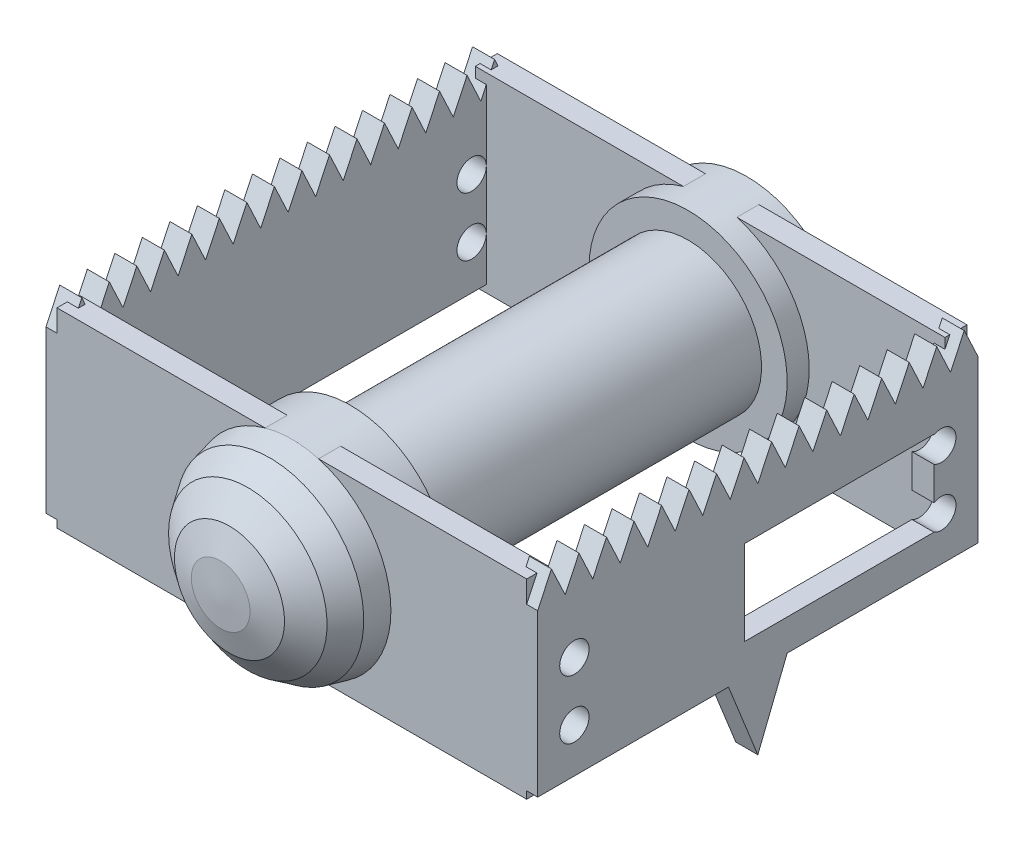
from build123d import *

# Parameters (mm, degrees)
PLACA_DELANTERA_START               = 203
PLACA_DELANTERA_DEPTH               = 3
AGUJERO_PLACA_DELANTERA_1_PROFILE_R = 2
AGUJERO_PLACA_DELANTERA_2_PROFILE_R = 2
AGUJERO_PLACA_DELANTERA_3_PROFILE_R = 2
AGUJERO_PLACA_DELANTERA_4_PROFILE_R = 2
PLACA_TRASERA_START                 = 139
PLACA_TRASERA_DEPTH                 = 3
AGUJERO_PLACA_TRASERA_1_PROFILE_R   = 2
AGUJERO_PLACA_TRASERA_2_PROFILE_R   = 2
AGUJERO_PLACA_TRASERA_3_PROFILE_R   = 2
AGUJERO_PLACA_TRASERA_4_PROFILE_R   = 2
MARCO_INTERIOR_START                = 86
SK_MARCO_INTERIOR_W                 = 64
SK_MARCO_INTERIOR_H                 = 26
SK_MARCO_INTERIOR_R                 = 11
MARCO_INTERIOR_DEPTH                = 3
MARCO_EXTERIOR_START                = 143
SK_MARCO_EXTERIOR_W                 = 64
SK_MARCO_EXTERIOR_H                 = 26
SK_MARCO_EXTERIOR_R                 = 11
MARCO_EXTERIOR_DEPTH                = 3
CROQUIS17_W                         = 25.795648089
CROQUIS17_H                         = 11.561302328
CORTAR_EXTRUIR1_DEPTH               = 10


with BuildPart() as part:
    # Sk_Eje_cuerpo → Eje_cuerpo (revolve)
    with BuildSketch(Plane(origin=(0, 0, 0), x_dir=(1, 0, 0), z_dir=(0, 1, 0))):
        Polygon((183.5, -84), (186, -84), (186, -92), (182.5, -92), (182.5, -138), (186, -138), (186, -146), (185.3, -149), (183.3, -152), (180, -154.5), (176.5, -155.7), (172.5, -156), (172.5, -147), (183.5, -147), (183.5, -138.5), (178.8, -138.5), (178.8, -91.5), (183.5, -91.5), align=None)
    revolve(axis=Axis((172.5, 0, 62.1), (0, 0, 1)))



with BuildPart() as body_2:
    # Sk_Placa_delantera → Placa_delantera (new body)
    with BuildSketch(Plane(origin=(0, 0, 0), x_dir=(0, 0, -1), z_dir=(1, 0, 0)).offset(PLACA_DELANTERA_START)):
        Polygon((-86, -12), (-112, -12), (-116, -22), (-120, -12), (-146, -12), (-146, 10), (-144.125, 14), (-142.25, 10), (-140.375, 14), (-138.5, 10), (-136.625, 14), (-134.75, 10), (-132.875, 14), (-131, 10), (-129.125, 14), (-127.25, 10), (-125.375, 14), (-123.5, 10), (-121.625, 14), (-119.75, 10), (-117.875, 14), (-116, 10), (-114.125, 14), (-112.25, 10), (-110.375, 14), (-108.5, 10), (-106.625, 14), (-104.75, 10), (-102.875, 14), (-101, 10), (-99.125, 14), (-97.25, 10), (-95.375, 14), (-93.5, 10), (-91.625, 14), (-89.75, 10), (-87.875, 14), (-86, 10), align=None)
    extrude(amount=PLACA_DELANTERA_DEPTH)

    # Agujero_Placa_delantera_1: sweep along a curve in space
    with BuildLine() as agujero_placa_delantera_1_path:
        Line((201.5, -6, 91), (207.5, -6, 91))
    # Agujero_Placa_delantera_1 profile (on start of the path) → Agujero_Placa_delantera_1 (sweep, cut)
    with BuildSketch(Plane(origin=(201.5, -6, 91), x_dir=(0, 0, 1), z_dir=(1, 0, 0))):
        Circle(AGUJERO_PLACA_DELANTERA_1_PROFILE_R)
    sweep(path=agujero_placa_delantera_1_path.line, mode=Mode.SUBTRACT)

    # Agujero_Placa_delantera_2: sweep along a curve in space
    with BuildLine() as agujero_placa_delantera_2_path:
        Line((201.5, 2, 91), (207.5, 2, 91))
    # Agujero_Placa_delantera_2 profile (on start of the path) → Agujero_Placa_delantera_2 (sweep, cut)
    with BuildSketch(Plane(origin=(201.5, 2, 91), x_dir=(0, 0, 1), z_dir=(1, 0, 0))):
        Circle(AGUJERO_PLACA_DELANTERA_2_PROFILE_R)
    sweep(path=agujero_placa_delantera_2_path.line, mode=Mode.SUBTRACT)

    # Agujero_Placa_delantera_3: sweep along a curve in space
    with BuildLine() as agujero_placa_delantera_3_path:
        Line((201.5, -6, 141), (207.5, -6, 141))
    # Agujero_Placa_delantera_3 profile (on start of the path) → Agujero_Placa_delantera_3 (sweep, cut)
    with BuildSketch(Plane(origin=(201.5, -6, 141), x_dir=(0, 0, 1), z_dir=(1, 0, 0))):
        Circle(AGUJERO_PLACA_DELANTERA_3_PROFILE_R)
    sweep(path=agujero_placa_delantera_3_path.line, mode=Mode.SUBTRACT)

    # Agujero_Placa_delantera_4: sweep along a curve in space
    with BuildLine() as agujero_placa_delantera_4_path:
        Line((201.5, 2, 141), (207.5, 2, 141))
    # Agujero_Placa_delantera_4 profile (on start of the path) → Agujero_Placa_delantera_4 (sweep, cut)
    with BuildSketch(Plane(origin=(201.5, 2, 141), x_dir=(0, 0, 1), z_dir=(1, 0, 0))):
        Circle(AGUJERO_PLACA_DELANTERA_4_PROFILE_R)
    sweep(path=agujero_placa_delantera_4_path.line, mode=Mode.SUBTRACT)


with BuildPart() as body_3:
    # Sk_Placa_trasera → Placa_trasera (new body)
    with BuildSketch(Plane(origin=(0, 0, 0), x_dir=(0, 0, -1), z_dir=(1, 0, 0)).offset(PLACA_TRASERA_START)):
        Polygon((-86, -12), (-146, -12), (-146, 10), (-144.125, 14), (-142.25, 10), (-140.375, 14), (-138.5, 10), (-136.625, 14), (-134.75, 10), (-132.875, 14), (-131, 10), (-129.125, 14), (-127.25, 10), (-125.375, 14), (-123.5, 10), (-121.625, 14), (-119.75, 10), (-117.875, 14), (-116, 10), (-114.125, 14), (-112.25, 10), (-110.375, 14), (-108.5, 10), (-106.625, 14), (-104.75, 10), (-102.875, 14), (-101, 10), (-99.125, 14), (-97.25, 10), (-95.375, 14), (-93.5, 10), (-91.625, 14), (-89.75, 10), (-87.875, 14), (-86, 10), align=None)
    extrude(amount=PLACA_TRASERA_DEPTH)

    # Agujero_Placa_trasera_1: sweep along a curve in space
    with BuildLine() as agujero_placa_trasera_1_path:
        Line((137.5, -6, 91), (143.5, -6, 91))
    # Agujero_Placa_trasera_1 profile (on start of the path) → Agujero_Placa_trasera_1 (sweep, cut)
    with BuildSketch(Plane(origin=(137.5, -6, 91), x_dir=(0, 0, 1), z_dir=(1, 0, 0))):
        Circle(AGUJERO_PLACA_TRASERA_1_PROFILE_R)
    sweep(path=agujero_placa_trasera_1_path.line, mode=Mode.SUBTRACT)

    # Agujero_Placa_trasera_2: sweep along a curve in space
    with BuildLine() as agujero_placa_trasera_2_path:
        Line((137.5, 2, 91), (143.5, 2, 91))
    # Agujero_Placa_trasera_2 profile (on start of the path) → Agujero_Placa_trasera_2 (sweep, cut)
    with BuildSketch(Plane(origin=(137.5, 2, 91), x_dir=(0, 0, 1), z_dir=(1, 0, 0))):
        Circle(AGUJERO_PLACA_TRASERA_2_PROFILE_R)
    sweep(path=agujero_placa_trasera_2_path.line, mode=Mode.SUBTRACT)

    # Agujero_Placa_trasera_3: sweep along a curve in space
    with BuildLine() as agujero_placa_trasera_3_path:
        Line((137.5, -6, 141), (143.5, -6, 141))
    # Agujero_Placa_trasera_3 profile (on start of the path) → Agujero_Placa_trasera_3 (sweep, cut)
    with BuildSketch(Plane(origin=(137.5, -6, 141), x_dir=(0, 0, 1), z_dir=(1, 0, 0))):
        Circle(AGUJERO_PLACA_TRASERA_3_PROFILE_R)
    sweep(path=agujero_placa_trasera_3_path.line, mode=Mode.SUBTRACT)

    # Agujero_Placa_trasera_4: sweep along a curve in space
    with BuildLine() as agujero_placa_trasera_4_path:
        Line((137.5, 2, 141), (143.5, 2, 141))
    # Agujero_Placa_trasera_4 profile (on start of the path) → Agujero_Placa_trasera_4 (sweep, cut)
    with BuildSketch(Plane(origin=(137.5, 2, 141), x_dir=(0, 0, 1), z_dir=(1, 0, 0))):
        Circle(AGUJERO_PLACA_TRASERA_4_PROFILE_R)
    sweep(path=agujero_placa_trasera_4_path.line, mode=Mode.SUBTRACT)


with BuildPart() as part_1:
    add(part.part)

    add(body_2.part)  # Marco_interior merges body 2

    add(body_3.part)  # Marco_interior merges body 3
    # Sk_Marco_interior → Marco_interior (add)
    with BuildSketch(Plane.XY.offset(MARCO_INTERIOR_START)):
        with Locations((172.5, 0)):
            Rectangle(SK_MARCO_INTERIOR_W, SK_MARCO_INTERIOR_H)
        with Locations((172.5, 0)):
            Circle(SK_MARCO_INTERIOR_R, mode=Mode.SUBTRACT)
    extrude(amount=MARCO_INTERIOR_DEPTH)

    # Sk_Marco_exterior → Marco_exterior (add)
    with BuildSketch(Plane.XY.offset(MARCO_EXTERIOR_START)):
        with Locations((172.5, 0)):
            Rectangle(SK_MARCO_EXTERIOR_W, SK_MARCO_EXTERIOR_H)
        with Locations((172.5, 0)):
            Circle(SK_MARCO_EXTERIOR_R, mode=Mode.SUBTRACT)
    extrude(amount=MARCO_EXTERIOR_DEPTH)

    # Croquis17 → Cortar-Extruir1 (cut)
    with BuildSketch(Plane(origin=(206, 0, 0), x_dir=(0, 0, -1), z_dir=(1, 0, 0))):
        with Locations((-104.897824044, -1.951399644)):
            Rectangle(CROQUIS17_W, CROQUIS17_H)
    extrude(amount=-CORTAR_EXTRUIR1_DEPTH, mode=Mode.SUBTRACT)


solid = part_1.part
